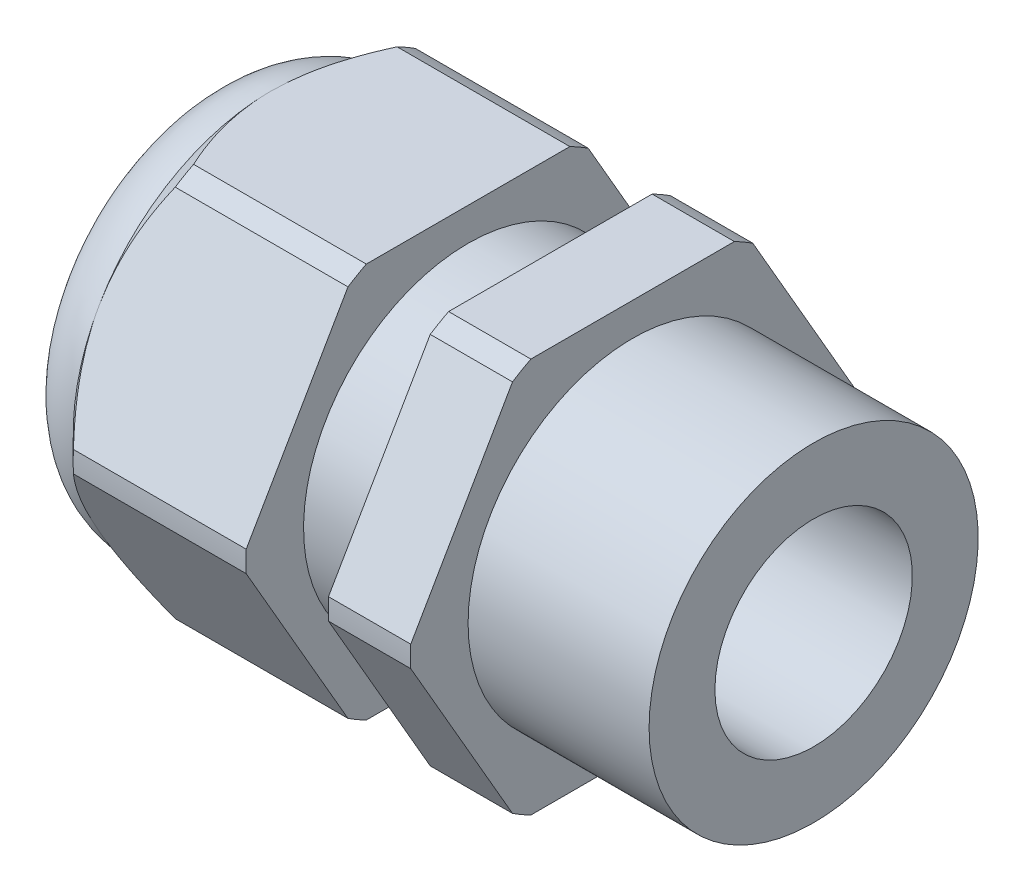
from build123d import *

# Parameters (mm, degrees)
BOSS_EXTRUDE1_DEPTH        = 10.5
BOSS_EXTRUDE1_2_OUTLINE_W  = 8
BOSS_EXTRUDE1_2_OUTLINE_H  = 5.5
BOSS_EXTRUDE1_START        = -23
BOSS_EXTRUDE1_3_DEPTH      = 2.5
SKETCH2_R                  = 10
BOSS_EXTRUDE2_DEPTH        = 5
BOSS_EXTRUDE3_DEPTH        = 5
SKETCH4_W                  = 11
SKETCH4_H                  = 10
F_12_0_12_DIAMETER_HOLE1_D = 12


with BuildPart() as part:
    # Boss-Extrude1: read off the stored shape, not the designer's step
    # Boss-Extrude1 outline → Boss-Extrude1 (new body)
    with BuildSketch(Plane(origin=(-20.5, 0, 0), x_dir=(0, 0, -1), z_dir=(1, 0, 0))):
        with BuildLine():
            ThreePointArc((-6.184658438, 12), (-6.75, 11.691342951), (-7.299975626, 11.356071321))
            Line((-7.299975626, 11.356071321), (-13.484634065, 0.643928679))
            ThreePointArc((-13.484634065, 0.643928679), (-13.5, 0), (-13.484634065, -0.643928679))
            Line((-13.484634065, -0.643928679), (-7.299975626, -11.356071321))
            ThreePointArc((-7.299975626, -11.356071321), (-6.75, -11.691342951), (-6.184658438, -12))
            Line((-6.184658438, -12), (6.184658438, -12))
            ThreePointArc((6.184658438, -12), (6.75, -11.691342951), (7.299975626, -11.356071321))
            Line((7.299975626, -11.356071321), (13.484634065, -0.643928679))
            ThreePointArc((13.484634065, -0.643928679), (13.5, 0), (13.484634065, 0.643928679))
            Line((13.484634065, 0.643928679), (7.299975626, 11.356071321))
            ThreePointArc((7.299975626, 11.356071321), (6.75, 11.691342951), (6.184658438, 12))
            Line((6.184658438, 12), (-6.184658438, 12))
        make_face()
    extrude(amount=BOSS_EXTRUDE1_DEPTH)

    # Boss-Extrude1 2 outline → Boss-Extrude1 2 (revolve)
    with BuildSketch(Plane.YX):
        with BuildLine():
            ThreePointArc((8, -26), (10.828427125, -24.828427125), (12, -22))
            Line((12, -22), (13.5, -20.5))
            Line((13.5, -20.5), (8, -20.5))
            Line((8, -20.5), (8, -26))
        make_face()
        with Locations((4, -23.25)):
            Rectangle(BOSS_EXTRUDE1_2_OUTLINE_W, BOSS_EXTRUDE1_2_OUTLINE_H)
    revolve(axis=Axis((0, 0, 0), (1, 0, 0)))

    # Boss-Extrude1 3 outline → Boss-Extrude1 3 (cut)
    with BuildSketch(Plane.YZ.offset(BOSS_EXTRUDE1_START)):
        Polygon((0.643928679, 13.484634065), (11.356071321, 7.299975626), (12, 6.92820323), (12, 15), (1.980762112, 15), (0, 13.856406461), align=None)
        Polygon((15, 5.196152422), (12, 6.92820323), (12, -6.92820323), (15, -5.196152422), align=None)
        Polygon((-0.643928679, 13.484634065), (0, 13.856406461), (-1.980762112, 15), (-12, 15), (-12, 6.92820323), (-11.356071321, 7.299975626), align=None)
        Polygon((12, -15), (12, -6.92820323), (11.356071321, -7.299975626), (0.643928679, -13.484634065), (0, -13.856406461), (1.980762112, -15), align=None)
        Polygon((-12, -6.92820323), (-12, 6.92820323), (-15, 5.196152422), (-15, -5.196152422), align=None)
        Polygon((-1.980762112, -15), (0, -13.856406461), (-0.643928679, -13.484634065), (-11.356071321, -7.299975626), (-12, -6.92820323), (-12, -15), align=None)
    extrude(amount=BOSS_EXTRUDE1_3_DEPTH, mode=Mode.SUBTRACT)

    # Sketch2 → Boss-Extrude2 (add)
    with BuildSketch(Plane(origin=(-10, 0, 0), x_dir=(0, 0, -1), z_dir=(1, 0, 0))):
        with Locations(Location((0, 0, 0), (0, 0, 90))):
            Circle(SKETCH2_R)
    extrude(amount=BOSS_EXTRUDE2_DEPTH)

    # Sketch3 → Boss-Extrude3 (add)
    with BuildSketch(Plane(origin=(-5, 0, 0), x_dir=(0, -1, 0), z_dir=(-1, 0, 0))):
        with BuildLine():
            Line((12, -6.184658438), (12, 6.184658438))
            ThreePointArc((12, 6.184658438), (11.691342951, 6.75), (11.356071321, 7.299975626))
            Line((11.356071321, 7.299975626), (0.643928679, 13.484634065))
            ThreePointArc((0.643928679, 13.484634065), (0, 13.5), (-0.643928679, 13.484634065))
            Line((-0.643928679, 13.484634065), (-11.356071321, 7.299975626))
            ThreePointArc((-11.356071321, 7.299975626), (-11.691342951, 6.75), (-12, 6.184658438))
            Line((-12, 6.184658438), (-12, -6.184658438))
            ThreePointArc((-12, -6.184658438), (-11.691342951, -6.75), (-11.356071321, -7.299975626))
            Line((-11.356071321, -7.299975626), (-0.643928679, -13.484634065))
            ThreePointArc((-0.643928679, -13.484634065), (0, -13.5), (0.643928679, -13.484634065))
            Line((0.643928679, -13.484634065), (11.356071321, -7.299975626))
            ThreePointArc((11.356071321, -7.299975626), (11.691342951, -6.75), (12, -6.184658438))
        make_face()
    extrude(amount=-BOSS_EXTRUDE3_DEPTH)

    # Sketch4 → Revolve1 (revolve)
    with BuildSketch(Plane(origin=(0, 0, 0), x_dir=(-1, 0, 0), z_dir=(0, 0, -1)), mode=Mode.PRIVATE) as revolve1_sk:
        with Locations((-5.5, 5)):
            Rectangle(SKETCH4_W, SKETCH4_H)
    revolve(revolve1_sk.sketch.rotate(Axis((11, 0, 0), (-1, 0, 0)), 270), axis=Axis((11, 0, 0), (-1, 0, 0)))

    # Ø12.0 (12) Diameter Hole1 (through all)
    with Locations(Plane.ZY.offset(26)):
        with Locations((0, 0)):
            Hole(F_12_0_12_DIAMETER_HOLE1_D / 2)


solid = part.part
